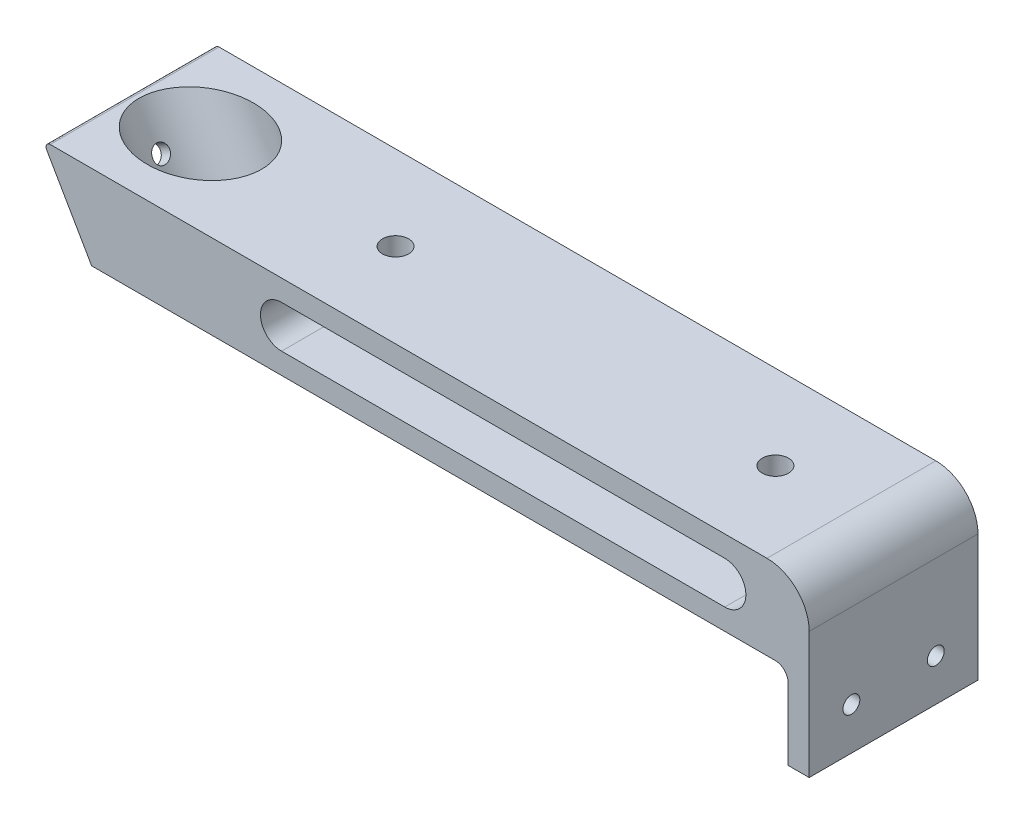
from build123d import *

# Parameters (mm, degrees)
EXTRUDE_1_DEPTH     = 40
SKETCH_2_R          = 12.6
CUT_EXTRUDE_1_DEPTH = 187.974102923
CUT_EXTRUDE_2_REACH = 177.784
SKETCH_3_R          = 2
SKETCH_4_W          = 5
SKETCH_4_H          = 40
EXTRUDE_2_DEPTH     = 20
SKETCH_5_R          = 2
CUT_EXTRUDE_3_DEPTH = 183.123159192
FILLET_1_R          = 10
FILLET_2_R          = 3
CUT_EXTRUDE_4_DEPTH = 176.783958324
SKETCH_7_R          = 3.1
CUT_EXTRUDE_5_DEPTH = 176.783958324
CUT_EXTRUDE_6_REACH = 177.784
FILLET_3_R          = 1


with BuildPart() as part:
    # 草图1 → 凸台-拉伸1 (new body)
    with BuildSketch(Plane.XY):
        Polygon((0, 0), (170, 0), (170, 20), (-11.547005384, 20), align=None)
    extrude(amount=EXTRUDE_1_DEPTH)

    # 草图2 → 切除-拉伸1 (cut, through all)
    with BuildSketch(Plane(origin=(-11.547005384, 20, 0), x_dir=(0, 0, -1), z_dir=(-0.4999999999999949, 0.8660254037844416, 0))):
        with Locations((-20, -15)):
            Circle(SKETCH_2_R)
    extrude(amount=-CUT_EXTRUDE_1_DEPTH, mode=Mode.SUBTRACT)

    # 草图3 → 切除-拉伸2 (cut, up to next)
    with BuildSketch(Plane(origin=(0, 0, 0), x_dir=(0, 0, 1), z_dir=(-0.8660254037844417, -0.4999999999999949, 0)), mode=Mode.PRIVATE) as cut_extrude_2_sk1:
        with Locations((20, 11.46723296)):
            Circle(SKETCH_3_R)
    cut_extrude_2_tool1 = extrude(cut_extrude_2_sk1.sketch, amount=-CUT_EXTRUDE_2_REACH, mode=Mode.PRIVATE) & part.part
    add(cut_extrude_2_tool1.solids().sort_by_distance((-5.733616, 9.930915, 20))[0], mode=Mode.SUBTRACT)

    # 草图4 → 凸台-拉伸2 (add)
    with BuildSketch(Plane.XZ):
        with Locations((167.5, 20)):
            Rectangle(SKETCH_4_W, SKETCH_4_H)
    extrude(amount=EXTRUDE_2_DEPTH)

    # 草图5 → 切除-拉伸3 (cut, through all)
    with BuildSketch(Plane.ZY.offset(-165)):
        with Locations((10, -10)):
            Circle(SKETCH_5_R)
        with Locations((30, -10)):
            Circle(SKETCH_5_R)
    extrude(amount=-CUT_EXTRUDE_3_DEPTH, mode=Mode.SUBTRACT)

    # 圆角1
    fillet_1_edges = [part.edges().sort_by_distance(p)[0] for p in [
        (170, 20, 20),
    ]]
    fillet(fillet_1_edges, radius=FILLET_1_R)

    # 圆角2
    fillet_2_edges = [part.edges().sort_by_distance(p)[0] for p in [
        (165, 0, 20),
    ]]
    fillet(fillet_2_edges, radius=FILLET_2_R)

    # 草图6 → 切除-拉伸4 (cut, through all)
    with BuildSketch(Plane(origin=(0, 0, 0), x_dir=(-1, 0, 0), z_dir=(0, 0, -1))):
        with BuildLine():
            Line((-150, 15), (-45, 15))
            ThreePointArc((-45, 15), (-40, 10), (-45, 5))
            Line((-45, 5), (-150, 5))
            ThreePointArc((-150, 5), (-155, 10), (-150, 15))
        make_face()
    extrude(amount=-CUT_EXTRUDE_4_DEPTH, mode=Mode.SUBTRACT)

    # 草图7 → 切除-拉伸5 (cut, through all)
    with BuildSketch(Plane.XZ):
        with Locations((52, 20)):
            Circle(SKETCH_7_R)
        with Locations((142, 20)):
            Circle(SKETCH_7_R)
    extrude(amount=-CUT_EXTRUDE_5_DEPTH, mode=Mode.SUBTRACT)

    # 草图8 → 切除-拉伸6 (cut, up to next)
    with BuildSketch(Plane.XZ, mode=Mode.PRIVATE) as cut_extrude_6_sk1:
        with BuildLine():
            Line((50, 30), (144, 30))
            ThreePointArc((144, 30), (146.121320344, 29.121320344), (147, 27))
            Line((147, 27), (147, 13))
            ThreePointArc((147, 13), (146.121320344, 10.878679656), (144, 10))
            Line((144, 10), (50, 10))
            ThreePointArc((50, 10), (47.878679656, 10.878679656), (47, 13))
            Line((47, 13), (47, 27))
            ThreePointArc((47, 27), (47.878679656, 29.121320344), (50, 30))
        make_face()
    cut_extrude_6_tool1 = extrude(cut_extrude_6_sk1.sketch, amount=-CUT_EXTRUDE_6_REACH, mode=Mode.PRIVATE) & part.part
    add(cut_extrude_6_tool1.solids().sort_by_distance((97, 0, 20))[0], mode=Mode.SUBTRACT)

    # 圆角3
    fillet_3_edges = [part.edges().sort_by_distance(p)[0] for p in [
        (-11.547005384, 20, 20),
    ]]
    fillet(fillet_3_edges, radius=FILLET_3_R)


solid = part.part
